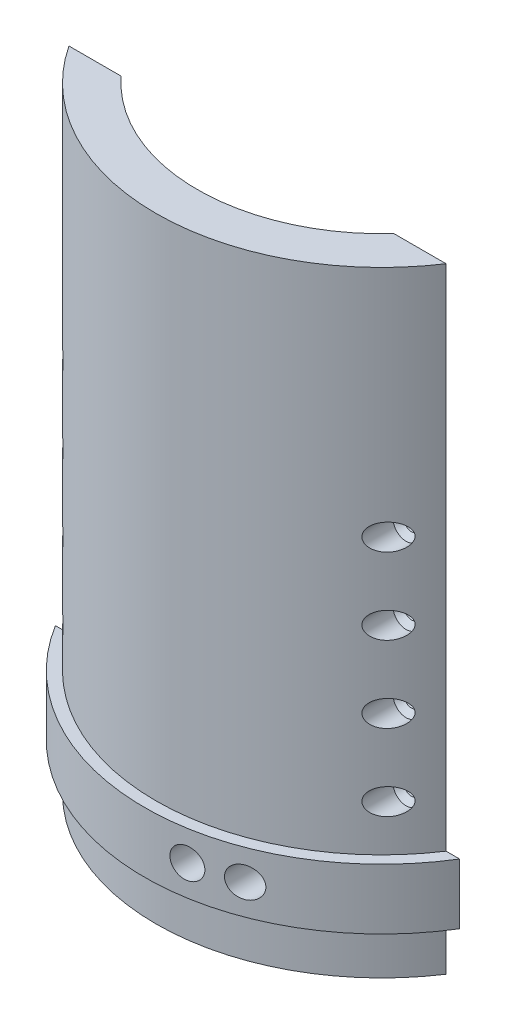
from build123d import *

# Parameters (mm, degrees)
BOSS_EXTRUDE1_DEPTH      = 102
LPATTERN1_COUNT          = 5
LPATTERN1_PITCH          = 17
BOSS_EXTRUDE2_DEPTH      = 6.731
BOSS_EXTRUDE2_DEPTH_BACK = 6.731
SKETCH9_R                = 3.334469726
CUT_EXTRUDE1_DEPTH       = 34
BOSS_EXTRUDE3_DEPTH      = 35


with BuildPart() as part:
    # Sketch1 → Boss-Extrude1 (new body)
    with BuildSketch(Plane(origin=(60.535204745, 0, -85.948449604), x_dir=(1, 0, 0), z_dir=(0, 1, 0))):
        with BuildLine():
            ThreePointArc((-30.186446753, -113.644462538), (-60.535204745, -127.035141416), (-90.883962736, -113.644462538))
            Line((-90.883962736, -113.644462538), (-102.513962844, -113.644462538))
            ThreePointArc((-102.513962844, -113.644462538), (-60.535204745, -136.240449604), (-18.556446645, -113.644462538))
            Line((-18.556446645, -113.644462538), (-30.186446753, -113.644462538))
        make_face()
    extrude(amount=BOSS_EXTRUDE1_DEPTH)

    # Sketch6 → Cut-Revolve4 (revolve, cut)
    with BuildSketch(Plane(origin=(36.163758045, 17, 27.696012934), x_dir=(-1, 0, 0), z_dir=(0, -1, 0))):
        Polygon((0, 1.685394277), (0, -4.78184701), (0, -15.185924704), (-2.9, -15.185924704), (-2.9, -3.079025683), (-1.65, -1.881964943), (-1.65, 1.685394277), align=None)
    cut_revolve4 = revolve(axis=Axis((36.163758045, 17, 26.010618657), (0, 0, 1)), mode=Mode.SUBTRACT)

    # LPattern1: Cut-Revolve4 ×5
    with Locations(*[(0, i * LPATTERN1_PITCH, 0) for i in range(1, LPATTERN1_COUNT)]):
        add(cut_revolve4, mode=Mode.SUBTRACT)

    # Mirror1: Cut-Revolve4 across plane
    add(cut_revolve4.mirror(Plane(origin=(0, 0, 0), x_dir=(0, 0, 1), z_dir=(1, 0, 0))), mode=Mode.SUBTRACT)

    # Mirror1 copy 1 sketch → Mirror1 copy 1 (revolve, cut)
    with BuildSketch(Plane(origin=(-36.163758045, 34, 27.696012934), x_dir=(1, 0, 0), z_dir=(0, -1, 0))):
        Polygon((0, -1.685394277), (0, 4.78184701), (0, 15.185924704), (-2.9, 15.185924704), (-2.9, 3.079025683), (-1.65, 1.881964943), (-1.65, -1.685394277), align=None)
    revolve(axis=Axis((-36.163758045, 34, 26.010618657), (0, 0, -1)), mode=Mode.SUBTRACT)

    # Mirror1 copy 2 sketch → Mirror1 copy 2 (revolve, cut)
    with BuildSketch(Plane(origin=(-36.163758045, 51, 27.696012934), x_dir=(1, 0, 0), z_dir=(0, -1, 0))):
        Polygon((0, -1.685394277), (0, 4.78184701), (0, 15.185924704), (-2.9, 15.185924704), (-2.9, 3.079025683), (-1.65, 1.881964943), (-1.65, -1.685394277), align=None)
    revolve(axis=Axis((-36.163758045, 51, 26.010618657), (0, 0, -1)), mode=Mode.SUBTRACT)

    # Mirror1 copy 3 sketch → Mirror1 copy 3 (revolve, cut)
    with BuildSketch(Plane(origin=(-36.163758045, 68, 27.696012934), x_dir=(1, 0, 0), z_dir=(0, -1, 0))):
        Polygon((0, -1.685394277), (0, 4.78184701), (0, 15.185924704), (-2.9, 15.185924704), (-2.9, 3.079025683), (-1.65, 1.881964943), (-1.65, -1.685394277), align=None)
    revolve(axis=Axis((-36.163758045, 68, 26.010618657), (0, 0, -1)), mode=Mode.SUBTRACT)

    # Mirror1 copy 4 sketch → Mirror1 copy 4 (revolve, cut)
    with BuildSketch(Plane(origin=(-36.163758045, 85, 27.696012934), x_dir=(1, 0, 0), z_dir=(0, -1, 0))):
        Polygon((0, -1.685394277), (0, 4.78184701), (0, 15.185924704), (-2.9, 15.185924704), (-2.9, 3.079025683), (-1.65, 1.881964943), (-1.65, -1.685394277), align=None)
    revolve(axis=Axis((-36.163758045, 85, 26.010618657), (0, 0, -1)), mode=Mode.SUBTRACT)

    # Sketch7 → Boss-Extrude2 (add, two sides: drawn at the far end of the back side and taken through both)
    with BuildSketch(Plane(origin=(0, 17, 0), x_dir=(-1, 0, 0), z_dir=(0, -1, 0)).offset(-BOSS_EXTRUDE2_DEPTH_BACK)):
        with BuildLine():
            Line((-44.990566695, -27.696012934), (-41.978758099, -27.696012934))
            ThreePointArc((-41.978758099, -27.696012934), (0, -50.292), (41.978758099, -27.696012934))
            Line((41.978758099, -27.696012934), (44.990566695, -27.696012934))
            ThreePointArc((44.990566695, -27.696012934), (0, -52.832), (-44.990566695, -27.696012934))
        make_face()
    extrude(amount=BOSS_EXTRUDE2_DEPTH + BOSS_EXTRUDE2_DEPTH_BACK)

    # Sketch9 → Cut-Extrude1 (cut)
    with BuildSketch(Plane(origin=(0, 0, 27.696012934), x_dir=(-1, 0, 0), z_dir=(0, 0, -1))):
        with Locations((-18.801989508, 17)):
            Circle(SKETCH9_R)
        with Locations((-8.69556827, 17)):
            Circle(SKETCH9_R)
    extrude(amount=-CUT_EXTRUDE1_DEPTH, mode=Mode.SUBTRACT)

    # Sketch10 → Boss-Extrude3 (add)
    with BuildSketch(Plane(origin=(0, 102, 0), x_dir=(1, 0, 0), z_dir=(0, 1, 0))):
        with BuildLine():
            Line((-30.348757991, -27.696012934), (-41.978758099, -27.696012934))
            ThreePointArc((-41.978758099, -27.696012934), (0, -50.292), (41.978758099, -27.696012934))
            Line((41.978758099, -27.696012934), (30.348757991, -27.696012934))
            ThreePointArc((30.348757991, -27.696012934), (0, -41.086691812), (-30.348757991, -27.696012934))
        make_face()
    extrude(amount=BOSS_EXTRUDE3_DEPTH)


solid = part.part
